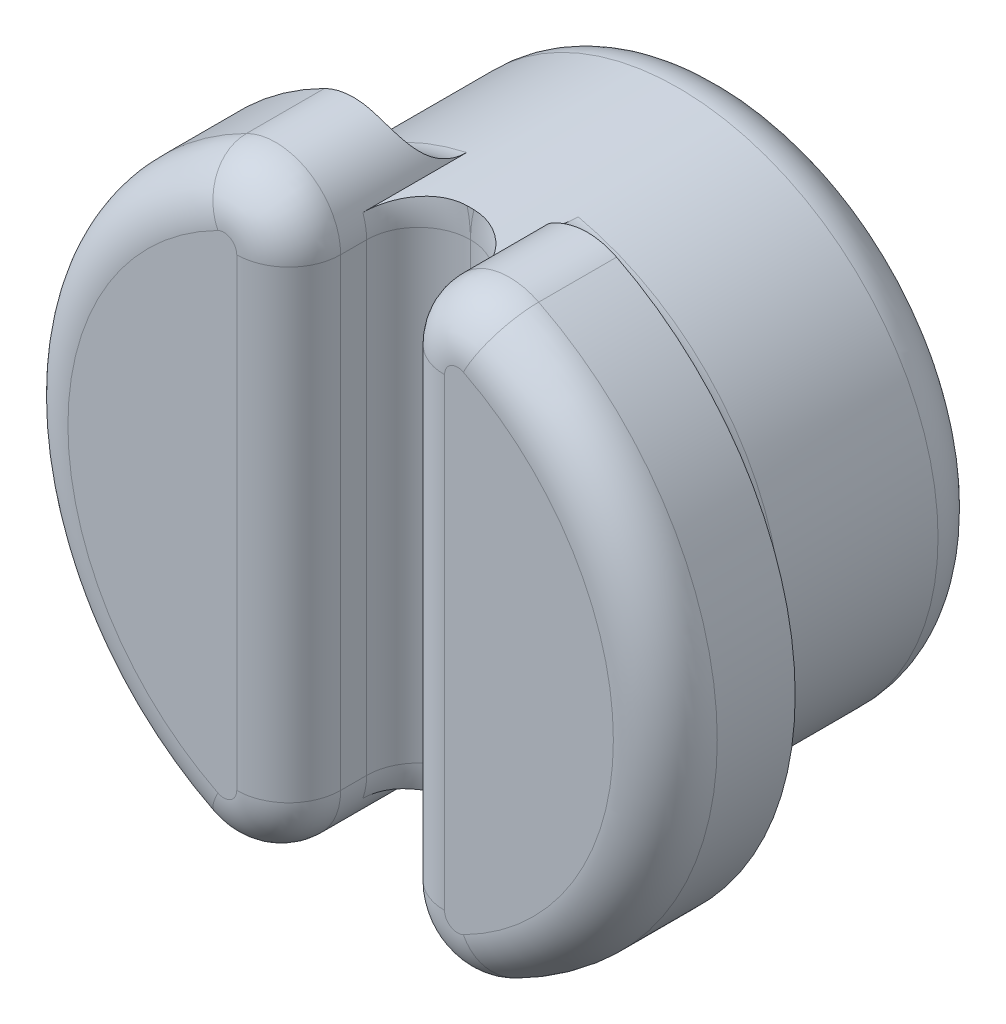
from build123d import *

# Parameters (mm, degrees)
ESQUISSE1_R        = 2
BOSS_EXTRU_1_DEPTH = 2
BOSS_EXTRU_2_DEPTH = 1
BOSS_EXTRU_3_DEPTH = 1
CONG_1_R           = 0.4
CONG_2_R           = 0.4


with BuildPart() as part:
    # Esquisse1 → Boss.-Extru.1 (new body)
    with BuildSketch(Plane.XY):
        Circle(ESQUISSE1_R)
    extrude(amount=BOSS_EXTRU_1_DEPTH)

    # Esquisse2 → Boss.-Extru.2 (add)
    with BuildSketch(Plane.XY.offset(2)):
        with BuildLine():
            Line((0.4, 1.78605711), (0.4, -1.78605711))
            ThreePointArc((0.4, -1.78605711), (0.637797788, -2.211791769), (1.125, -2.232571387))
            ThreePointArc((1.125, -2.232571387), (2.5, 0), (1.125, 2.232571387))
            ThreePointArc((1.125, 2.232571387), (0.637797788, 2.211791769), (0.4, 1.78605711))
        make_face()
    extrude(amount=BOSS_EXTRU_2_DEPTH)

    # Esquisse3 → Boss.-Extru.3 (add)
    with BuildSketch(Plane.XY.offset(2)):
        with BuildLine():
            Line((-0.4, 1.78605711), (-0.4, -1.78605711))
            ThreePointArc((-0.4, -1.78605711), (-0.637797788, -2.211791769), (-1.125, -2.232571387))
            ThreePointArc((-1.125, -2.232571387), (-2.5, 0), (-1.125, 2.232571387))
            ThreePointArc((-1.125, 2.232571387), (-0.637797788, 2.211791769), (-0.4, 1.78605711))
        make_face()
    extrude(amount=BOSS_EXTRU_3_DEPTH)

    # Congé1
    cong_1_edges = [part.edges().sort_by_distance(p)[0] for p in [
        (2.5, 0, 3),
        (-0.407268544, -1.871002459, 2),
        (-0.4, 0, 2),
        (-0.407268544, 1.871002459, 2),
        (-0.637797788, -2.211791769, 3),
        (-0.4, 0, 3),
        (-0.637797788, 2.211791769, 3),
        (-2.5, 0, 3),
        (0.407268544, 1.871002459, 2),
        (0.4, 0, 2),
        (0.407268544, -1.871002459, 2),
        (0.637797788, 2.211791769, 3),
        (0.4, 0, 3),
        (0.637797788, -2.211791769, 3),
    ]]
    fillet(cong_1_edges, radius=CONG_1_R - 0.0001)  # a hair under: the kernel refuses the full size

    # Congé2
    cong_2_edges = [part.edges().sort_by_distance(p)[0] for p in [
        (-2, 0, 0),
        (-2, 0, 2),
        (1.558480943, 1.253450099, 2),
    ]]
    fillet(cong_2_edges, radius=CONG_2_R)


solid = part.part
